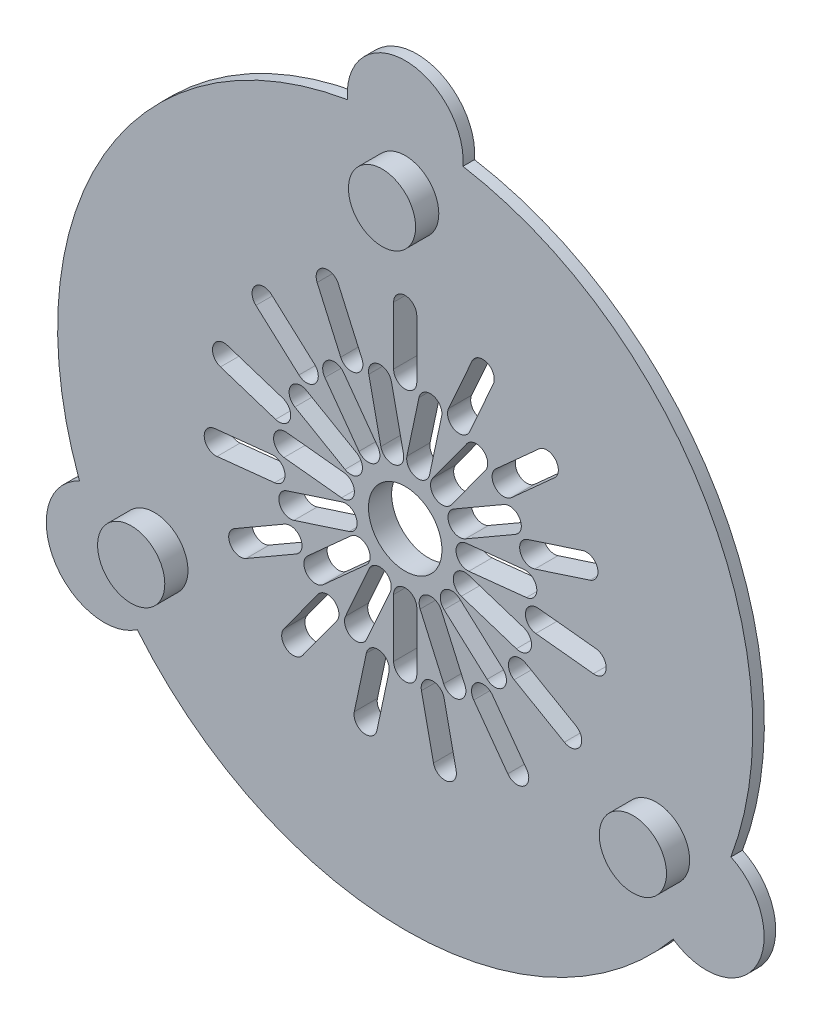
from build123d import *

# Parameters (mm, degrees)
SKETCH2_R           = 18.85
SKETCH2_R_2         = 3.171236328
BOSS_EXTRUDE1_DEPTH = 2
SKETCH3_R           = 30
SKETCH3_R_2         = 17.600030795
BOSS_EXTRUDE2_DEPTH = 1
SKETCH4_R           = 2.9
BOSS_EXTRUDE3_DEPTH = 2
SKETCH6_R           = 5
BOSS_EXTRUDE4_DEPTH = 1


with BuildPart() as part:
    # Sketch2 → Boss-Extrude1 (new body)
    with BuildSketch(Plane.XY.offset(10)):
        Circle(SKETCH2_R)
        with BuildLine():
            Line((-5.913455175, -9.842771463), (-8.852381436, -13.887856435))
            ThreePointArc((-8.852381436, -13.887856435), (-10.249183683, -14.109088177), (-10.470415425, -12.71228593))
            Line((-10.470415425, -12.71228593), (-7.531489164, -8.667200958))
            ThreePointArc((-7.531489164, -8.667200958), (-6.134686917, -8.445969216), (-5.913455175, -9.842771463))
        make_face(mode=Mode.SUBTRACT)
        with BuildLine():
            Line((-1.398794291, -11.397038067), (-2.438352745, -16.287776071))
            ThreePointArc((-2.438352745, -16.287776071), (-3.624412036, -17.058011981), (-4.394647946, -15.871952689))
            Line((-4.394647946, -15.871952689), (-3.355089492, -10.981214686))
            ThreePointArc((-3.355089492, -10.981214686), (-2.1690302, -10.210978776), (-1.398794291, -11.397038067))
        make_face(mode=Mode.SUBTRACT)
        with BuildLine():
            Line((-9.405625937, -6.586600254), (-13.735752956, -9.086600254))
            ThreePointArc((-13.735752956, -9.086600254), (-15.10177836, -8.72057485), (-14.735752956, -7.354549446))
            Line((-14.735752956, -7.354549446), (-10.405625937, -4.854549446))
            ThreePointArc((-10.405625937, -4.854549446), (-9.039600534, -5.22057485), (-9.405625937, -6.586600254))
        make_face(mode=Mode.SUBTRACT)
        with BuildLine():
            Line((-11.271478528, -2.191546023), (-16.244088005, -2.71418834))
            ThreePointArc((-16.244088005, -2.71418834), (-17.343138363, -1.824194908), (-16.453144931, -0.725144549))
            Line((-16.453144931, -0.725144549), (-11.480535454, -0.202502233))
            ThreePointArc((-11.480535454, -0.202502233), (-10.381485096, -1.092495665), (-11.271478528, -2.191546023))
        make_face(mode=Mode.SUBTRACT)
        with BuildLine():
            Line((-3.355934148, -4.367329409), (-7.071658276, -7.712982441))
            ThreePointArc((-7.071658276, -7.712982441), (-8.483933707, -7.638968222), (-8.409919488, -6.22669279))
            Line((-8.409919488, -6.22669279), (-4.694195361, -2.881039758))
            ThreePointArc((-4.694195361, -2.881039758), (-3.281919929, -2.955053977), (-3.355934148, -4.367329409))
        make_face(mode=Mode.SUBTRACT)
        with BuildLine():
            Line((-1.289445494, -5.354735334), (-3.32312871, -9.922462622))
            ThreePointArc((-3.32312871, -9.922462622), (-4.64341081, -10.429271436), (-5.150219625, -9.108989336))
            Line((-5.150219625, -9.108989336), (-3.11653641, -4.541262047))
            ThreePointArc((-3.11653641, -4.541262047), (-1.796254309, -4.034453233), (-1.289445494, -5.354735334))
        make_face(mode=Mode.SUBTRACT)
        with BuildLine():
            Line((1, -5.416258873), (1, -10.416258873))
            ThreePointArc((1, -10.416258873), (0, -11.416258873), (-1, -10.416258873))
            Line((-1, -10.416258873), (-1, -5.416258873))
            ThreePointArc((-1, -5.416258873), (0, -4.416258873), (1, -5.416258873))
        make_face(mode=Mode.SUBTRACT)
        with BuildLine():
            Line((-4.8421513, -2.624772554), (-9.597433882, -4.169857526))
            ThreePointArc((-9.597433882, -4.169857526), (-10.857507392, -3.527818004), (-10.215467871, -2.267744493))
            Line((-10.215467871, -2.267744493), (-5.460185289, -0.722659521))
            ThreePointArc((-5.460185289, -0.722659521), (-4.200111778, -1.364699043), (-4.8421513, -2.624772554))
        make_face(mode=Mode.SUBTRACT)
        with BuildLine():
            Line((3.357730834, -10.980653251), (4.397289288, -15.871391255))
            ThreePointArc((4.397289288, -15.871391255), (3.627053378, -17.057450546), (2.440994087, -16.287214636))
            Line((2.440994087, -16.287214636), (1.401435633, -11.396476633))
            ThreePointArc((1.401435633, -11.396476633), (2.171671543, -10.210417341), (3.357730834, -10.980653251))
        make_face(mode=Mode.SUBTRACT)
        with BuildLine():
            Line((7.533673794, -8.665613732), (10.472600055, -12.710698704))
            ThreePointArc((10.472600055, -12.710698704), (10.251368313, -14.10750095), (8.854566066, -13.886269208))
            Line((8.854566066, -13.886269208), (5.915639805, -9.841184236))
            ThreePointArc((5.915639805, -9.841184236), (6.136871547, -8.44438199), (7.533673794, -8.665613732))
        make_face(mode=Mode.SUBTRACT)
        with BuildLine():
            Line((3.11653641, -4.541262047), (5.150219625, -9.108989336))
            ThreePointArc((5.150219625, -9.108989336), (4.64341081, -10.429271436), (3.32312871, -9.922462622))
            Line((3.32312871, -9.922462622), (1.289445494, -5.354735334))
            ThreePointArc((1.289445494, -5.354735334), (1.796254309, -4.034453233), (3.11653641, -4.541262047))
        make_face(mode=Mode.SUBTRACT)
        with BuildLine():
            Line((4.694195361, -2.881039758), (8.409919488, -6.22669279))
            ThreePointArc((8.409919488, -6.22669279), (8.483933707, -7.638968222), (7.071658276, -7.712982441))
            Line((7.071658276, -7.712982441), (3.355934148, -4.367329409))
            ThreePointArc((3.355934148, -4.367329409), (3.281919929, -2.955053977), (4.694195361, -2.881039758))
        make_face(mode=Mode.SUBTRACT)
        with BuildLine():
            Line((5.460185289, -0.722659521), (10.215467871, -2.267744493))
            ThreePointArc((10.215467871, -2.267744493), (10.857507392, -3.527818004), (9.597433882, -4.169857526))
            Line((9.597433882, -4.169857526), (4.8421513, -2.624772554))
            ThreePointArc((4.8421513, -2.624772554), (4.200111778, -1.364699043), (5.460185289, -0.722659521))
        make_face(mode=Mode.SUBTRACT)
        with BuildLine():
            Line((10.406976113, -4.852210873), (14.737103132, -7.352210873))
            ThreePointArc((14.737103132, -7.352210873), (15.103128536, -8.718236277), (13.737103132, -9.084261681))
            Line((13.737103132, -9.084261681), (9.406976113, -6.584261681))
            ThreePointArc((9.406976113, -6.584261681), (9.040950709, -5.218236277), (10.406976113, -4.852210873))
        make_face(mode=Mode.SUBTRACT)
        with BuildLine():
            Line((11.480817718, -0.199816674), (16.453427195, -0.72245899))
            ThreePointArc((16.453427195, -0.72245899), (17.343420627, -1.821509349), (16.244370268, -2.711502781))
            Line((16.244370268, -2.711502781), (11.271760791, -2.188860465))
            ThreePointArc((11.271760791, -2.188860465), (10.381767359, -1.089810106), (11.480817718, -0.199816674))
        make_face(mode=Mode.SUBTRACT)
        with BuildLine():
            Line((-11.188390083, 2.582446424), (-15.943672664, 4.127531396))
            ThreePointArc((-15.943672664, 4.127531396), (-16.585712186, 5.387604907), (-15.325638675, 6.029644429))
            Line((-15.325638675, 6.029644429), (-10.570356094, 4.484559457))
            ThreePointArc((-10.570356094, 4.484559457), (-9.928316572, 3.224485946), (-11.188390083, 2.582446424))
        make_face(mode=Mode.SUBTRACT)
        with BuildLine():
            Line((-9.170727349, 6.909910424), (-12.886451476, 10.255563456))
            ThreePointArc((-12.886451476, 10.255563456), (-12.960465695, 11.667838888), (-11.548190264, 11.741853107))
            Line((-11.548190264, 11.741853107), (-7.832466136, 8.396200075))
            ThreePointArc((-7.832466136, 8.396200075), (-7.758451917, 6.983924643), (-9.170727349, 6.909910424))
        make_face(mode=Mode.SUBTRACT)
        with BuildLine():
            Line((-5.491116503, -0.428368679), (-10.46372598, 0.094273638))
            ThreePointArc((-10.46372598, 0.094273638), (-11.353719412, 1.193323996), (-10.254669053, 2.083317428))
            Line((-10.254669053, 2.083317428), (-5.282059577, 1.560675112))
            ThreePointArc((-5.282059577, 1.560675112), (-4.392066144, 0.461624753), (-5.491116503, -0.428368679))
        make_face(mode=Mode.SUBTRACT)
        with BuildLine():
            Line((-5.190617777, 1.842104033), (-9.520744796, 4.342104033))
            ThreePointArc((-9.520744796, 4.342104033), (-9.8867702, 5.708129436), (-8.520744796, 6.07415484))
            Line((-8.520744796, 6.07415484), (-4.190617777, 3.57415484))
            ThreePointArc((-4.190617777, 3.57415484), (-3.824592373, 2.208129436), (-5.190617777, 1.842104033))
        make_face(mode=Mode.SUBTRACT)
        with BuildLine():
            Line((-3.992614082, 3.794060222), (-6.931540344, 7.839145193))
            ThreePointArc((-6.931540344, 7.839145193), (-6.710308602, 9.23594744), (-5.313506355, 9.014715698))
            Line((-5.313506355, 9.014715698), (-2.374580094, 4.969630726))
            ThreePointArc((-2.374580094, 4.969630726), (-2.595811836, 3.572828479), (-3.992614082, 3.794060222))
        make_face(mode=Mode.SUBTRACT)
        with BuildLine():
            ThreePointArc((-3.143809595, 9.980726934), (-2.373573685, 11.166786226), (-1.187514393, 10.396550316))
            Line((-1.187514393, 10.396550316), (-0.147955939, 5.505812312))
            ThreePointArc((-0.147955939, 5.505812312), (-0.918191849, 4.31975302), (-2.104251141, 5.08998893))
            Line((-2.104251141, 5.08998893), (-3.143809595, 9.980726934))
        make_face(mode=Mode.SUBTRACT)
        with BuildLine():
            Line((-5.567362543, 10.042588137), (-7.601045758, 14.610315425))
            ThreePointArc((-7.601045758, 14.610315425), (-7.094236944, 15.930597526), (-5.773954843, 15.423788711))
            Line((-5.773954843, 15.423788711), (-3.740271628, 10.856061423))
            ThreePointArc((-3.740271628, 10.856061423), (-4.247080442, 9.535779322), (-5.567362543, 10.042588137))
        make_face(mode=Mode.SUBTRACT)
        with BuildLine():
            ThreePointArc((-1.001350176, 16.438811127), (-0.001350176, 17.438811127), (0.998649824, 16.438811127))
            Line((0.998649824, 16.438811127), (0.998649824, 11.438811127))
            ThreePointArc((0.998649824, 11.438811127), (-0.001350176, 10.438811127), (-1.001350176, 11.438811127))
            Line((-1.001350176, 11.438811127), (-1.001350176, 16.438811127))
        make_face(mode=Mode.SUBTRACT)
        Circle(SKETCH2_R_2, mode=Mode.SUBTRACT)
        with BuildLine():
            Line((5.282059577, 1.560675112), (10.254669053, 2.083317428))
            ThreePointArc((10.254669053, 2.083317428), (11.353719412, 1.193323996), (10.46372598, 0.094273638))
            Line((10.46372598, 0.094273638), (5.491116503, -0.428368679))
            ThreePointArc((5.491116503, -0.428368679), (4.392066144, 0.461624753), (5.282059577, 1.560675112))
        make_face(mode=Mode.SUBTRACT)
        with BuildLine():
            Line((4.190617777, 3.57415484), (8.520744796, 6.07415484))
            ThreePointArc((8.520744796, 6.07415484), (9.8867702, 5.708129436), (9.520744796, 4.342104033))
            Line((9.520744796, 4.342104033), (5.190617777, 1.842104033))
            ThreePointArc((5.190617777, 1.842104033), (3.824592373, 2.208129436), (4.190617777, 3.57415484))
        make_face(mode=Mode.SUBTRACT)
        with BuildLine():
            Line((2.374580094, 4.969630726), (5.313506355, 9.014715698))
            ThreePointArc((5.313506355, 9.014715698), (6.710308602, 9.23594744), (6.931540344, 7.839145193))
            Line((6.931540344, 7.839145193), (3.992614082, 3.794060222))
            ThreePointArc((3.992614082, 3.794060222), (2.595811836, 3.572828479), (2.374580094, 4.969630726))
        make_face(mode=Mode.SUBTRACT)
        with BuildLine():
            Line((0.147955939, 5.505812312), (1.187514393, 10.396550316))
            ThreePointArc((1.187514393, 10.396550316), (2.373573685, 11.166786226), (3.143809595, 9.980726934))
            Line((3.143809595, 9.980726934), (2.104251141, 5.08998893))
            ThreePointArc((2.104251141, 5.08998893), (0.918191849, 4.31975302), (0.147955939, 5.505812312))
        make_face(mode=Mode.SUBTRACT)
        with BuildLine():
            Line((10.56952164, 4.487127643), (15.324804221, 6.032212615))
            ThreePointArc((15.324804221, 6.032212615), (16.584877732, 5.390173093), (15.94283821, 4.130099583))
            Line((15.94283821, 4.130099583), (11.187555628, 2.585014611))
            ThreePointArc((11.187555628, 2.585014611), (9.927482118, 3.227054133), (10.56952164, 4.487127643))
        make_face(mode=Mode.SUBTRACT)
        with BuildLine():
            Line((7.830659249, 8.398206827), (11.546383376, 11.743859859))
            ThreePointArc((11.546383376, 11.743859859), (12.958658808, 11.66984564), (12.884644589, 10.257570208))
            Line((12.884644589, 10.257570208), (9.168920461, 6.911917176))
            ThreePointArc((9.168920461, 6.911917176), (7.756645029, 6.985931395), (7.830659249, 8.398206827))
        make_face(mode=Mode.SUBTRACT)
        with BuildLine():
            Line((3.737804734, 10.857159755), (5.77148795, 15.424887043))
            ThreePointArc((5.77148795, 15.424887043), (7.09177005, 15.931695858), (7.598578865, 14.611413757))
            Line((7.598578865, 14.611413757), (5.564895649, 10.043686469))
            ThreePointArc((5.564895649, 10.043686469), (4.244613549, 9.536877654), (3.737804734, 10.857159755))
        make_face(mode=Mode.SUBTRACT)
    extrude(amount=BOSS_EXTRUDE1_DEPTH)

    # Sketch3 → Boss-Extrude2 (add)
    with BuildSketch(Plane.XY.offset(12)):
        Circle(SKETCH3_R)
        Circle(SKETCH3_R_2, mode=Mode.SUBTRACT)
    extrude(amount=-BOSS_EXTRUDE2_DEPTH)

    # Sketch4 → Boss-Extrude3 (add)
    with BuildSketch(Plane.XY.offset(12)):
        with Locations((0, 25)):
            Circle(SKETCH4_R)
        with Locations((21.650635095, -12.5)):
            Circle(SKETCH4_R)
        with Locations((-21.650635095, -12.5)):
            Circle(SKETCH4_R)
    extrude(amount=BOSS_EXTRUDE3_DEPTH)

    # Sketch6 → Boss-Extrude4 (add)
    with BuildSketch(Plane(origin=(0, 0, 11), x_dir=(-1, 0, 0), z_dir=(0, 0, -1))):
        with Locations((0, 30)):
            Circle(SKETCH6_R)
        with Locations((25.980762114, -15)):
            Circle(SKETCH6_R)
        with Locations((-25.980762114, -15)):
            Circle(SKETCH6_R)
    extrude(amount=-BOSS_EXTRUDE4_DEPTH)


solid = part.part
